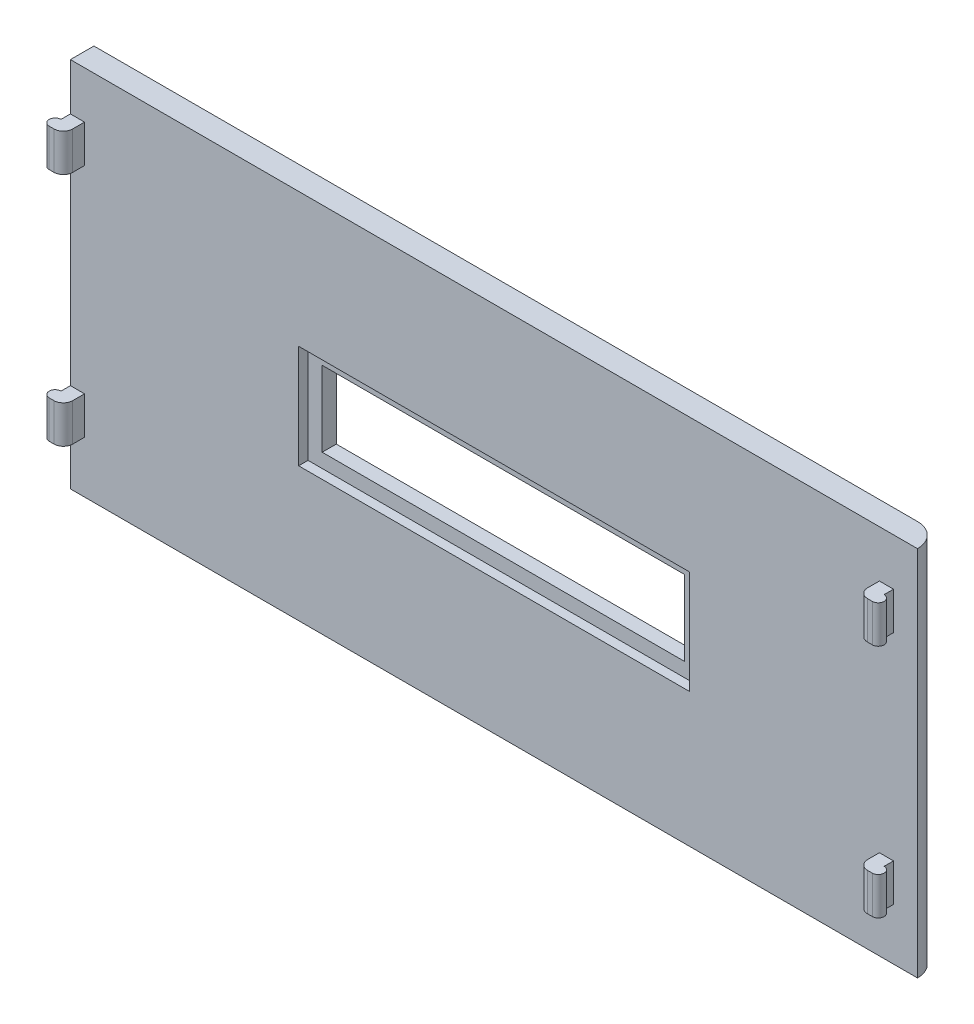
from build123d import *

# Parameters (mm, degrees)
SKETCH1_W            = 180
SKETCH1_H            = 79
BOSS_EXTRUDE1_DEPTH  = 5
FILLET1_R            = 5
SKETCH2_W            = 3
SKETCH2_H            = 8
BOSS_EXTRUDE2_DEPTH  = 4.5
FILLET2_R            = 2
SKETCH3_R            = 1.25
BOSS_EXTRUDE3_DEPTH  = 8
LPATTERN1_COUNT      = 2
LPATTERN1_PITCH      = 50
LPATTERN1_COUNT_DIR2 = 2
LPATTERN1_PITCH_DIR2 = 174.9
SKETCH4_W            = 83
SKETCH4_H            = 22
CUT_EXTRUDE1_DEPTH   = 2
SKETCH5_W            = 77
SKETCH5_H            = 16
CUT_EXTRUDE2_DEPTH   = 3


with BuildPart() as part:
    # Sketch1 → Boss-Extrude1 (new body)
    with BuildSketch(Plane.XY):
        Rectangle(SKETCH1_W, SKETCH1_H)
    extrude(amount=BOSS_EXTRUDE1_DEPTH)

    # Fillet1
    fillet1_edges = [part.edges().sort_by_distance(p)[0] for p in [
        (90, 0, 0),
    ]]
    fillet(fillet1_edges, radius=FILLET1_R - 0.0001)  # a hair under: the kernel refuses the full size

    # Sketch2 → Boss-Extrude2 (add)
    with BuildSketch(Plane.XY.offset(5)):
        with Locations((-88.5, -24.5)):
            Rectangle(SKETCH2_W, SKETCH2_H)
        with Locations((-88.5, 25.5)):
            Rectangle(SKETCH2_W, SKETCH2_H)
        with Locations((83.4, 25.5)):
            Rectangle(SKETCH2_W, SKETCH2_H)
        with Locations((83.4, -24.5)):
            Rectangle(SKETCH2_W, SKETCH2_H)
    extrude(amount=BOSS_EXTRUDE2_DEPTH)

    # Fillet2
    fillet2_edges = [part.edges().sort_by_distance(p)[0] for p in [
        (-87, -24.5, 9.5),
        (-87, 25.5, 9.5),
        (81.9, 25.5, 9.5),
        (81.9, -24.5, 9.5),
    ]]
    fillet(fillet2_edges, radius=FILLET2_R)

    # Sketch3 → Boss-Extrude3 (add)
    with BuildSketch(Plane(origin=(0, 29.5, 0), x_dir=(1, 0, 0), z_dir=(0, 1, 0))):
        with Locations((84.9, -8.25)):
            Circle(SKETCH3_R)
    boss_extrude3 = extrude(amount=-BOSS_EXTRUDE3_DEPTH)

    # LPattern1: Boss-Extrude3 2 × 2
    with Locations(*[(-j * LPATTERN1_PITCH_DIR2, -i * LPATTERN1_PITCH, 0) for i in range(LPATTERN1_COUNT) for j in range(LPATTERN1_COUNT_DIR2) if (i, j) != (0, 0)]):
        add(boss_extrude3)

    # Sketch4 → Cut-Extrude1 (cut)
    with BuildSketch(Plane.XY.offset(5)):
        Rectangle(SKETCH4_W, SKETCH4_H)
    extrude(amount=-CUT_EXTRUDE1_DEPTH, mode=Mode.SUBTRACT)

    # Sketch5 → Cut-Extrude2 (cut)
    with BuildSketch(Plane.XY.offset(3)):
        Rectangle(SKETCH5_W, SKETCH5_H)
    extrude(amount=-CUT_EXTRUDE2_DEPTH, mode=Mode.SUBTRACT)


solid = part.part
